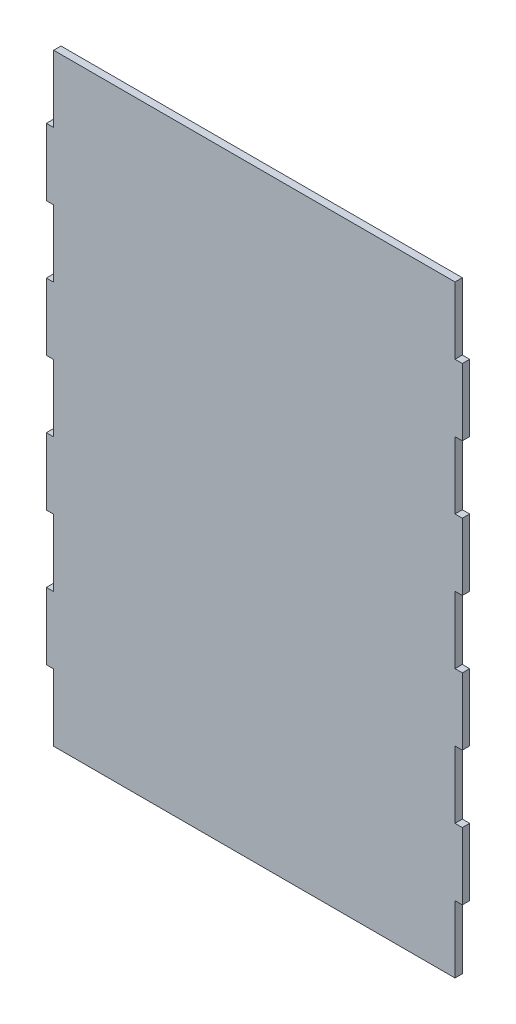
from build123d import *

# Parameters (mm, degrees)
BOSS_EXTRUDE2_DEPTH = 2.7


with BuildPart() as part:
    # Sketch1 → Boss-Extrude2 (new body)
    with BuildSketch(Plane.XY):
        Polygon((46.02, -108.65), (74, -108.65), (74, -83.95), (76.7, -83.95), (76.7, -59.25), (74, -59.25), (74, -34.55), (76.7, -34.55), (76.7, -9.85), (74, -9.85), (74, 14.85), (76.7, 14.85), (76.7, 39.55), (74, 39.55), (74, 64.25), (76.7, 64.25), (76.7, 88.95), (74, 88.95), (74, 113.65), (-74, 113.65), (-74, 88.95), (-76.7, 88.95), (-76.7, 64.25), (-74, 64.25), (-74, 39.55), (-76.7, 39.55), (-76.7, 14.85), (-74, 14.85), (-74, -9.85), (-76.7, -9.85), (-76.7, -34.55), (-74, -34.55), (-74, -59.25), (-76.7, -59.25), (-76.7, -61.75), (-76.7, -83.95), (-74, -83.95), (-74, -108.65), (-46.02, -108.65), align=None)
    extrude(amount=BOSS_EXTRUDE2_DEPTH)


solid = part.part
